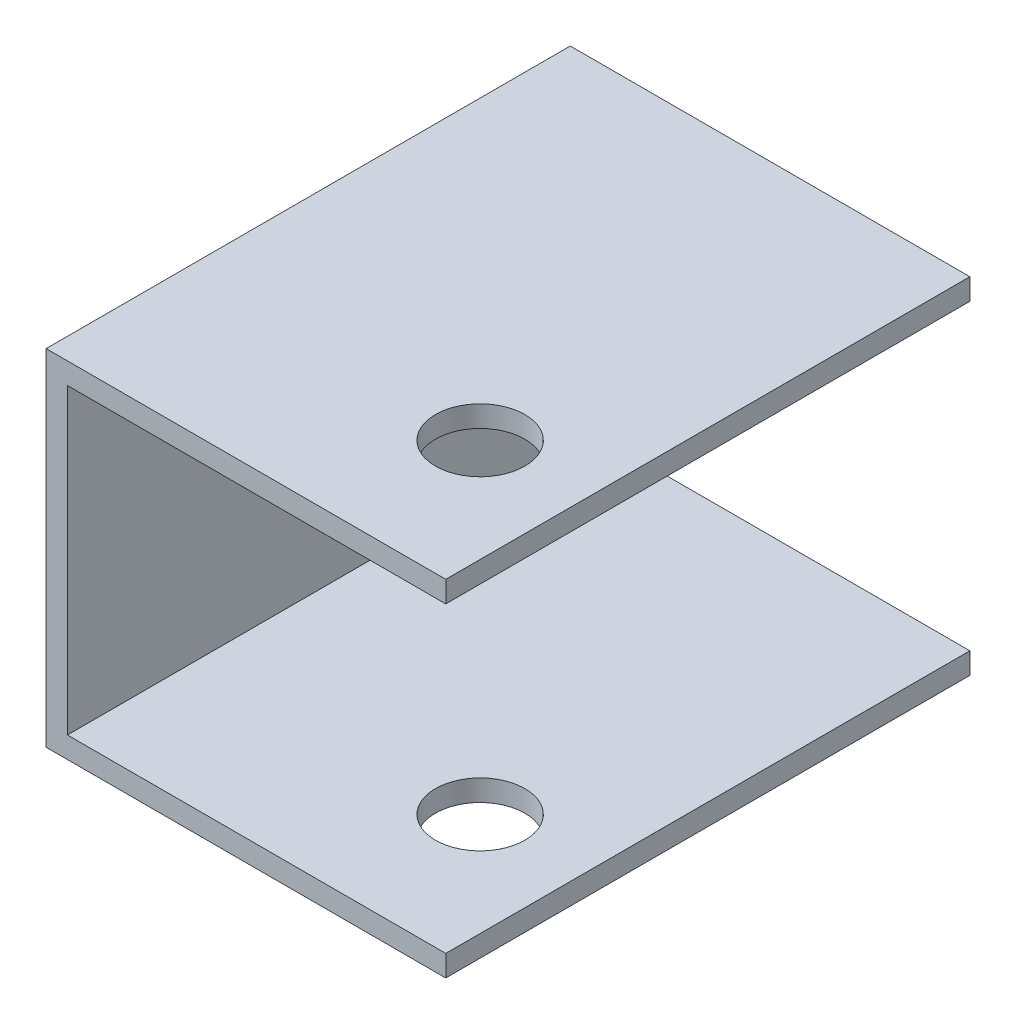
from build123d import *

# Parameters (mm, degrees)
SALIENTE_EXTRUIR3_DEPTH = 38.1
CROQUIS7_R              = 6.5
CORTAR_EXTRUIR1_DEPTH   = 5
CROQUIS8_R              = 6.5
CORTAR_EXTRUIR2_DEPTH   = 70


with BuildPart() as part:
    # Croquis6 → Saliente-Extruir3 (new, symmetric)
    with BuildSketch(Plane.XY):
        Polygon((55, 22), (0, 22), (0, -22), (55, -22), (55, -25.1), (-3.1, -25.1), (-3.1, 25.1), (55, 25.1), align=None)
    extrude(amount=SALIENTE_EXTRUIR3_DEPTH, both=True)

    # Croquis7 → Cortar-Extruir1 (cut)
    with BuildSketch(Plane.ZY.offset(3.1)):
        Circle(CROQUIS7_R)
    extrude(amount=-CORTAR_EXTRUIR1_DEPTH, mode=Mode.SUBTRACT)

    # Croquis8 → Cortar-Extruir2 (cut)
    with BuildSketch(Plane.XZ.offset(25.1)):
        with Locations((40, 18.1)):
            Circle(CROQUIS8_R)
    extrude(amount=-CORTAR_EXTRUIR2_DEPTH, mode=Mode.SUBTRACT)


solid = part.part
